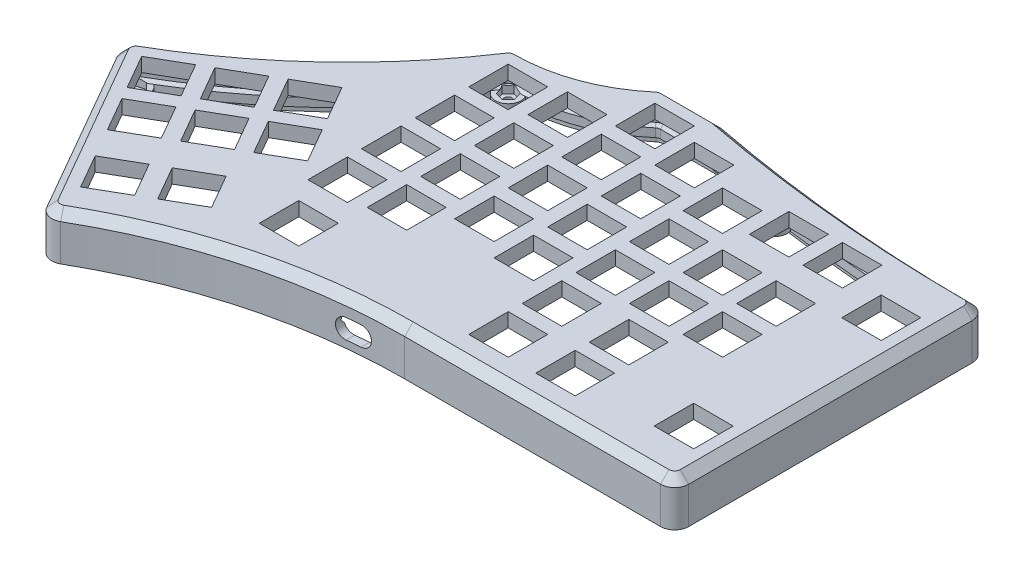
from build123d import *

# Parameters (mm, degrees)
SKETCH3_W                = 14
SKETCH3_H                = 14
MAIN_PLATE_DEPTH         = 5
MAIN_PLATE_CHAMFER_SIZE  = 3
WALL_DEPTH               = 11
NICE_NANO_RECESS_DEPTH   = 2
MAIN_SWITCH_RECESS_DEPTH = 2
SIDE_START               = -3
SIDE_DEPTH               = 3
FASTENERS_START          = -3
SKETCH8_R                = 1.35
FASTENERS_DEPTH          = 3
CHAMFER1_SIZE            = 1
NUT_SOCCETS_DEPTH        = 2
SKETCH11_R               = 3
MAGNET01_DEPTH           = 1.5
SKETCH10_R               = 3
MAGNET02_DEPTH           = 1.5
CHARGE_SOCCET_DEPTH      = 5


with BuildPart() as part:
    # Sketch3 → Main_plate (new body)
    with BuildSketch(Plane(origin=(0, 0, 0), x_dir=(1, 0, 0), z_dir=(0, 1, 0))):
        with BuildLine():
            Line((160, 22.5), (160, -78))
            ThreePointArc((160, -78), (158.535533906, -81.535533906), (155, -83))
            Line((155, -83), (64.287339008, -83))
            ThreePointArc((64.287339008, -83), (14.482679281, -89.533952399), (-31.951197412, -108.693591219))
            ThreePointArc((-31.951197412, -108.693591219), (-35.746191671, -109.186216339), (-38.77799641, -106.851088727))
            Line((-38.77799641, -106.851088727), (-72.421997828, -48.333303664))
            ThreePointArc((-72.421997828, -48.333303664), (-72.914622948, -44.538309405), (-70.579495335, -41.506504666))
            ThreePointArc((-70.579495335, -41.506504666), (-33.753261114, -14.230305993), (-4.165423102, 20.765727822))
            ThreePointArc((-4.165423102, 20.765727822), (-2.363404419, 22.406168353), (0, 23))
            ThreePointArc((0, 23), (18.519929937, 26.303047313), (34.756097561, 35.804878049))
            ThreePointArc((34.756097561, 35.804878049), (36.271473206, 36.691715584), (38, 37))
            Line((38, 37), (56, 37))
            ThreePointArc((56, 37), (56.477604071, 36.977137164), (56.950840389, 36.90875774))
            ThreePointArc((56.950840389, 36.90875774), (105.750222278, 29.85757953), (155, 27.5))
            ThreePointArc((155, 27.5), (158.535533906, 26.035533906), (160, 22.5))
        make_face()
        with Locations((104, 13.5)):
            Rectangle(SKETCH3_W, SKETCH3_H, mode=Mode.SUBTRACT)
        Polygon((-65.356627483, -46.578156408), (-53.219605396, -39.600141299), (-46.241590287, -51.737163386), (-58.378612374, -58.715178495), align=None, mode=Mode.SUBTRACT)
        with Locations((9, -10)):
            Rectangle(SKETCH3_W, SKETCH3_H, mode=Mode.SUBTRACT)
        with Locations((9, 9)):
            Rectangle(SKETCH3_W, SKETCH3_H, mode=Mode.SUBTRACT)
        with Locations((28, 11)):
            Rectangle(SKETCH3_W, SKETCH3_H, mode=Mode.SUBTRACT)
        with Locations((47, 23)):
            Rectangle(SKETCH3_W, SKETCH3_H, mode=Mode.SUBTRACT)
        with Locations((66, 18)):
            Rectangle(SKETCH3_W, SKETCH3_H, mode=Mode.SUBTRACT)
        with Locations((85, 9)):
            Rectangle(SKETCH3_W, SKETCH3_H, mode=Mode.SUBTRACT)
        with Locations((104, -10)):
            Rectangle(SKETCH3_W, SKETCH3_H, mode=Mode.SUBTRACT)
        with Locations((123, -10)):
            Rectangle(SKETCH3_W, SKETCH3_H, mode=Mode.SUBTRACT)
        with Locations((146, 4.25)):
            Rectangle(SKETCH3_W, SKETCH3_H, mode=Mode.SUBTRACT)
        with Locations((146, -62.25)):
            Rectangle(SKETCH3_W, SKETCH3_H, mode=Mode.SUBTRACT)
        with Locations((28, -8)):
            Rectangle(SKETCH3_W, SKETCH3_H, mode=Mode.SUBTRACT)
        with Locations((47, 4)):
            Rectangle(SKETCH3_W, SKETCH3_H, mode=Mode.SUBTRACT)
        with Locations((66, -1)):
            Rectangle(SKETCH3_W, SKETCH3_H, mode=Mode.SUBTRACT)
        with Locations((85, -10)):
            Rectangle(SKETCH3_W, SKETCH3_H, mode=Mode.SUBTRACT)
        with Locations((104, -29)):
            Rectangle(SKETCH3_W, SKETCH3_H, mode=Mode.SUBTRACT)
        with Locations((123, -29)):
            Rectangle(SKETCH3_W, SKETCH3_H, mode=Mode.SUBTRACT)
        with Locations((9, -29)):
            Rectangle(SKETCH3_W, SKETCH3_H, mode=Mode.SUBTRACT)
        with Locations((28, -27)):
            Rectangle(SKETCH3_W, SKETCH3_H, mode=Mode.SUBTRACT)
        with Locations((47, -15)):
            Rectangle(SKETCH3_W, SKETCH3_H, mode=Mode.SUBTRACT)
        with Locations((66, -20)):
            Rectangle(SKETCH3_W, SKETCH3_H, mode=Mode.SUBTRACT)
        with Locations((85, -29)):
            Rectangle(SKETCH3_W, SKETCH3_H, mode=Mode.SUBTRACT)
        with Locations((9, -48)):
            Rectangle(SKETCH3_W, SKETCH3_H, mode=Mode.SUBTRACT)
        with Locations((28, -46)):
            Rectangle(SKETCH3_W, SKETCH3_H, mode=Mode.SUBTRACT)
        with Locations((47, -34)):
            Rectangle(SKETCH3_W, SKETCH3_H, mode=Mode.SUBTRACT)
        with Locations((66, -39)):
            Rectangle(SKETCH3_W, SKETCH3_H, mode=Mode.SUBTRACT)
        with Locations((85, -48)):
            Rectangle(SKETCH3_W, SKETCH3_H, mode=Mode.SUBTRACT)
        with Locations((13.75, -70)):
            Rectangle(SKETCH3_W, SKETCH3_H, mode=Mode.SUBTRACT)
        with Locations((108.75, -67)):
            Rectangle(SKETCH3_W, SKETCH3_H, mode=Mode.SUBTRACT)
        Polygon((-30.91487853, -78.39526547), (-43.051900617, -85.373280579), (-36.073885508, -97.510302666), (-23.936863421, -90.532287557), align=None, mode=Mode.SUBTRACT)
        Polygon((-25.713297636, -75.404687566), (-13.576275549, -68.426672458), (-6.59826044, -80.563694545), (-18.735282527, -87.541709654), align=None, mode=Mode.SUBTRACT)
        with Locations((123, 13.5)):
            Rectangle(SKETCH3_W, SKETCH3_H, mode=Mode.SUBTRACT)
        with Locations((108.75, -48)):
            Rectangle(SKETCH3_W, SKETCH3_H, mode=Mode.SUBTRACT)
        Polygon((-55.886464121, -63.04982924), (-43.749442034, -56.071814132), (-36.771426925, -68.208836219), (-48.908449012, -75.186851327), align=None, mode=Mode.SUBTRACT)
        Polygon((-48.884954651, -37.107993046), (-36.747932564, -30.129977937), (-29.769917455, -42.267000024), (-41.906939542, -49.245015133), align=None, mode=Mode.SUBTRACT)
        Polygon((-32.413281818, -27.637829684), (-20.276259731, -20.659814575), (-13.298244622, -32.796836662), (-25.435266709, -39.774851771), align=None, mode=Mode.SUBTRACT)
        Polygon((-22.943118456, -44.109502517), (-10.806096369, -37.131487408), (-3.82808126, -49.268509495), (-15.965103347, -56.246524604), align=None, mode=Mode.SUBTRACT)
        Polygon((-39.414791289, -53.579665878), (-27.277769202, -46.60165077), (-20.299754093, -58.738672857), (-32.43677618, -65.716687966), align=None, mode=Mode.SUBTRACT)
        with Locations((85, -67)):
            Rectangle(SKETCH3_W, SKETCH3_H, mode=Mode.SUBTRACT)
    extrude(amount=-MAIN_PLATE_DEPTH)

    # Main_plate_chamfer
    main_plate_chamfer_edges = [part.edges().sort_by_distance(p)[0] for p in [
        (-35.746191671, 0, 109.186216339),
        (-55.599997119, 0, 77.592196196),
        (-72.914622948, 0, 44.538309405),
        (-33.753261114, 0, 14.230305993),
        (-2.363404419, 0, -22.406168353),
        (18.519929937, 0, -26.303047313),
        (36.271473206, 0, -36.691715584),
        (47, 0, -37),
        (56.477604071, 0, -36.977137164),
        (105.750222278, 0, -29.85757953),
        (158.535533906, 0, -26.035533906),
        (160, 0, 27.75),
        (158.535533906, 0, 81.535533906),
        (109.643669504, 0, 83),
        (14.482679281, 0, 89.533952399),
    ]]
    chamfer(main_plate_chamfer_edges, length=MAIN_PLATE_CHAMFER_SIZE)

    # Sketch4 → Wall (add)
    with BuildSketch(Plane.XZ.offset(5)):
        with BuildLine():
            Line((155, 83), (64.287339008, 83))
            ThreePointArc((64.287339008, 83), (14.482679281, 89.533952399), (-31.951197412, 108.693591219))
            ThreePointArc((-31.951197412, 108.693591219), (-35.746191671, 109.186216339), (-38.77799641, 106.851088727))
            Line((-38.77799641, 106.851088727), (-72.421997828, 48.333303664))
            ThreePointArc((-72.421997828, 48.333303664), (-72.914622948, 44.538309405), (-70.579495335, 41.506504666))
            ThreePointArc((-70.579495335, 41.506504666), (-33.753261114, 14.230305993), (-4.165423102, -20.765727822))
            ThreePointArc((-4.165423102, -20.765727822), (-2.363404419, -22.406168353), (0, -23))
            ThreePointArc((0, -23), (18.519929937, -26.303047313), (34.756097561, -35.804878049))
            ThreePointArc((34.756097561, -35.804878049), (36.271473206, -36.691715584), (38, -37))
            Line((38, -37), (56, -37))
            ThreePointArc((56, -37), (56.477604071, -36.977137164), (56.950840389, -36.90875774))
            ThreePointArc((56.950840389, -36.90875774), (105.750222278, -29.85757953), (155, -27.5))
            ThreePointArc((155, -27.5), (158.535533906, -26.035533906), (160, -22.5))
            Line((160, -22.5), (160, 78))
            ThreePointArc((160, 78), (158.535533906, 81.535533906), (155, 83))
        make_face()
        with BuildLine():
            Line((-37.044136112, 105.854229426), (-70.68813753, 47.336444363))
            ThreePointArc((-70.68813753, 47.336444363), (-70.983712602, 45.059447807), (-69.582636034, 43.240364964))
            ThreePointArc((-69.582636034, 43.240364964), (-32.385273168, 15.689281312), (-2.499253861, -19.659436693))
            ThreePointArc((-2.499253861, -19.659436693), (-1.418042651, -20.643701012), (0, -21))
            ThreePointArc((0, -21), (19.211340655, -24.42636108), (36.053658537, -34.282926829))
            ThreePointArc((36.053658537, -34.282926829), (36.962883924, -34.81502935), (38, -35))
            Line((38, -35), (56, -35))
            ThreePointArc((56, -35), (56.286562443, -34.986282299), (56.570504234, -34.945254644))
            ThreePointArc((56.570504234, -34.945254644), (105.55918065, -27.866724665), (155, -25.5))
            ThreePointArc((155, -25.5), (157.121320344, -24.621320344), (158, -22.5))
            Line((158, -22.5), (158, 78))
            ThreePointArc((158, 78), (157.121320344, 80.121320344), (155, 81))
            Line((155, 81), (64.287339008, 81))
            ThreePointArc((64.287339008, 81), (13.966791986, 87.601632473), (-32.948056713, 106.959730921))
            ThreePointArc((-32.948056713, 106.959730921), (-35.225053269, 107.255305993), (-37.044136112, 105.854229426))
        make_face(mode=Mode.SUBTRACT)
    extrude(amount=WALL_DEPTH)

    # Sketch6 → Nice-nano_recess (cut)
    with BuildSketch(Plane.XZ.offset(5)):
        with BuildLine():
            Line((56.12, 75.25), (56.12, 44.77))
            ThreePointArc((56.12, 44.77), (54.62, 43.27), (53.12, 44.77))
            Line((53.12, 44.77), (53.12, 75.25))
            ThreePointArc((53.12, 75.25), (54.62, 76.75), (56.12, 75.25))
        make_face()
        with BuildLine():
            Line((40.88, 75.25), (40.88, 44.77))
            ThreePointArc((40.88, 44.77), (39.38, 43.27), (37.88, 44.77))
            Line((37.88, 44.77), (37.88, 75.25))
            ThreePointArc((37.88, 75.25), (39.38, 76.75), (40.88, 75.25))
        make_face()
    extrude(amount=-NICE_NANO_RECESS_DEPTH, mode=Mode.SUBTRACT)

    # Sketch12 → Main_switch_recess (cut)
    with BuildSketch(Plane.XZ.offset(5)):
        with BuildLine():
            Line((65, 76.5), (69, 76.5))
            ThreePointArc((69, 76.5), (70.5, 75), (69, 73.5))
            Line((69, 73.5), (65, 73.5))
            ThreePointArc((65, 73.5), (63.5, 75), (65, 76.5))
        make_face()
        with BuildLine():
            Line((65, 68.5), (69, 68.5))
            ThreePointArc((69, 68.5), (70.5, 70), (69, 71.5))
            Line((69, 71.5), (65, 71.5))
            ThreePointArc((65, 71.5), (63.5, 70), (65, 68.5))
        make_face()
    extrude(amount=-MAIN_SWITCH_RECESS_DEPTH, mode=Mode.SUBTRACT)

    # Sketch7 → Side (add)
    with BuildSketch(Plane(origin=(0, -14, 0), x_dir=(-1, 0, 0), z_dir=(0, -1, 0)).offset(SIDE_START)):
        with BuildLine():
            Line((-158, 22.5), (-158, -78))
            ThreePointArc((-158, -78), (-157.121320344, -80.121320344), (-155, -81))
            Line((-155, -81), (-64.287339008, -81))
            ThreePointArc((-64.287339008, -81), (-13.966791986, -87.601632473), (32.948056713, -106.959730921))
            ThreePointArc((32.948056713, -106.959730921), (35.225053269, -107.255305993), (37.044136112, -105.854229426))
            Line((37.044136112, -105.854229426), (70.68813753, -47.336444363))
            ThreePointArc((70.68813753, -47.336444363), (70.983712602, -45.059447807), (69.582636034, -43.240364964))
            ThreePointArc((69.582636034, -43.240364964), (32.385273168, -15.689281312), (2.499253861, 19.659436693))
            ThreePointArc((2.499253861, 19.659436693), (1.418042651, 20.643701012), (0, 21))
            ThreePointArc((0, 21), (-19.211340655, 24.42636108), (-36.053658537, 34.282926829))
            ThreePointArc((-36.053658537, 34.282926829), (-36.962883924, 34.81502935), (-38, 35))
            Line((-38, 35), (-56, 35))
            ThreePointArc((-56, 35), (-56.286562443, 34.986282299), (-56.570504234, 34.945254644))
            ThreePointArc((-56.570504234, 34.945254644), (-105.55918065, 27.866724665), (-155, 25.5))
            ThreePointArc((-155, 25.5), (-157.121320344, 24.621320344), (-158, 22.5))
        make_face()
        with BuildLine():
            Line((-38, 34), (-56, 34))
            ThreePointArc((-56, 34), (-56.191041629, 33.990854866), (-56.380336156, 33.963503096))
            ThreePointArc((-56.380336156, 33.963503096), (-105.463659835, 26.871297232), (-155, 24.5))
            ThreePointArc((-155, 24.5), (-156.414213562, 23.914213562), (-157, 22.5))
            Line((-157, 22.5), (-157, -78))
            ThreePointArc((-157, -78), (-156.414213562, -79.414213562), (-155, -80))
            Line((-155, -80), (-64.287339008, -80))
            ThreePointArc((-64.287339008, -80), (-13.708848338, -86.63547251), (33.446486364, -106.092800772))
            ThreePointArc((33.446486364, -106.092800772), (34.964484067, -106.28985082), (36.177205963, -105.355799775))
            Line((36.177205963, -105.355799775), (69.82120738, -46.838014712))
            ThreePointArc((69.82120738, -46.838014712), (70.018257429, -45.320017009), (69.084206384, -44.107295113))
            ThreePointArc((69.084206384, -44.107295113), (31.701279195, -16.418768971), (1.666169241, 19.106291129))
            ThreePointArc((1.666169241, 19.106291129), (0.945361767, 19.762467341), (0, 20))
            ThreePointArc((0, 20), (-19.557046014, 23.488017963), (-36.702439024, 33.52195122))
            ThreePointArc((-36.702439024, 33.52195122), (-37.308589282, 33.876686234), (-38, 34))
        make_face(mode=Mode.SUBTRACT)
    extrude(amount=SIDE_DEPTH)

    # Sketch8 → Fasteners (add)
    # profile 1 of 7: a face of its own
    with BuildSketch(Plane.XZ.offset(14).offset(FASTENERS_START)):
        with BuildLine():
            Line((72.584345221, 81), (79.292549153, 81))
            ThreePointArc((79.292549153, 81), (75.938447187, 73.5), (72.584345221, 81))
        make_face()
        with Locations(Location((75.938447187, 78, 0), (0, 0, 270))):
            Circle(SKETCH8_R, mode=Mode.SUBTRACT)
    # profile 2 of 7: a face of its own
    with BuildSketch(Plane.XZ.offset(14).offset(FASTENERS_START)):
        with BuildLine():
            Line((158, 78), (158, 74.645898034))
            ThreePointArc((158, 74.645898034), (151.818019485, 74.818019485), (151.645898034, 81))
            Line((151.645898034, 81), (155, 81))
            ThreePointArc((155, 81), (157.121320344, 80.121320344), (158, 78))
        make_face()
        with Locations(Location((155, 78, 0), (0, 0, 270))):
            Circle(SKETCH8_R, mode=Mode.SUBTRACT)
    # profile 3 of 7: a face of its own
    with BuildSketch(Plane.XZ.offset(14).offset(FASTENERS_START)):
        with BuildLine():
            Line((158, -19.145898034), (158, -22.5))
            ThreePointArc((158, -22.5), (157.121320344, -24.621320344), (155, -25.5))
            Line((155, -25.5), (151.655593741, -25.510805004))
            ThreePointArc((151.655593741, -25.510805004), (151.812890949, -19.3231563), (158, -19.145898034))
        make_face()
        with Locations(Location((155, -22.5, 0), (0, 0, 270))):
            Circle(SKETCH8_R, mode=Mode.SUBTRACT)
    # profile 4 of 7: a face of its own
    with BuildSketch(Plane.XZ.offset(14).offset(FASTENERS_START)):
        with BuildLine():
            Line((0, -21), (3.265663403, -21.096036585))
            ThreePointArc((3.265663403, -21.096036585), (2.168070686, -14.056718435), (-4.363800284, -16.90125204))
            Line((-4.363800284, -16.90125204), (-2.499253861, -19.659436693))
            ThreePointArc((-2.499253861, -19.659436693), (-1.418042651, -20.643701012), (0, -21))
        make_face()
        with Locations(Location((0, -18, 0), (0, 0, 270))):
            Circle(SKETCH8_R, mode=Mode.SUBTRACT)
    # profile 5 of 7: a face of its own
    with BuildSketch(Plane.XZ.offset(14).offset(FASTENERS_START)):
        with BuildLine():
            Line((-69.016353658, 50.244216481), (-70.68813753, 47.336444363))
            ThreePointArc((-70.68813753, 47.336444363), (-70.983712602, 45.059447807), (-69.582636034, 43.240364964))
            Line((-69.582636034, 43.240364964), (-66.710261221, 41.557041205))
            ThreePointArc((-66.710261221, 41.557041205), (-63.737985367, 46.995734413), (-69.016353658, 50.244216481))
        make_face()
        with Locations(Location((-68.087347082, 45.841155411, 0), (0, 0, 270))):
            Circle(SKETCH8_R, mode=Mode.SUBTRACT)
    # profile 6 of 7: a face of its own
    with BuildSketch(Plane.XZ.offset(14).offset(FASTENERS_START)):
        with BuildLine():
            Line((-37.044136112, 105.854229426), (-38.715919983, 102.946457308))
            ThreePointArc((-38.715919983, 102.946457308), (-33.252333202, 100.019414081), (-30.048338945, 105.325333734))
            Line((-30.048338945, 105.325333734), (-32.948056713, 106.959730921))
            ThreePointArc((-32.948056713, 106.959730921), (-35.225053269, 107.255305993), (-37.044136112, 105.854229426))
        make_face()
        with Locations(Location((-34.443345665, 104.358940474, 0), (0, 0, 270))):
            Circle(SKETCH8_R, mode=Mode.SUBTRACT)
    # profile 7 of 7: a face of its own
    with BuildSketch(Plane.XZ.offset(14).offset(FASTENERS_START)):
        with BuildLine():
            ThreePointArc((81.873992234, -30.691700873), (85.373293343, -30.204486821), (88.875838606, -29.741170024))
            ThreePointArc((88.875838606, -29.741170024), (84.394658116, -22.995616625), (81.873992234, -30.691700873))
        make_face()
        with Locations(Location((85, -27.454715324, 0), (0, 0, 270))):
            Circle(SKETCH8_R, mode=Mode.SUBTRACT)
    extrude(amount=FASTENERS_DEPTH)

    # Chamfer1
    chamfer1_edges = [part.edges().sort_by_distance(p)[0] for p in [
        (56.286562443, -11, -34.986282299),
        (47, -11, -35),
        (36.962883924, -11, -34.81502935),
        (19.211340655, -11, -24.42636108),
        (-1.418042651, -11, -20.643701012),
        (-32.385273168, -11, 15.689281312),
        (-70.983712602, -11, 45.059447807),
        (-53.866136821, -11, 76.595336894),
        (-35.225053269, -11, 107.255305993),
        (13.966791986, -11, 87.601632473),
        (109.643669504, -11, 81),
        (157.121320344, -11, 80.121320344),
        (158, -11, 27.75),
        (105.55918065, -11, -27.866724665),
    ]]
    chamfer(chamfer1_edges, length=CHAMFER1_SIZE - 0.0001)  # a hair under: the kernel refuses the full size

    # Sketch9 → Nut_soccets (cut, symmetric)
    with BuildSketch(Plane(origin=(0, -11, 0), x_dir=(1, 0, 0), z_dir=(0, 1, 0))):
        Polygon((-65.188167162, -45.069951295), (-67.305639478, -42.944789892), (-70.204819399, -43.715994008), (-70.986527003, -46.612359528), (-68.869054686, -48.737520931), (-65.969874766, -47.966316814), align=None)
        Polygon((-32.943345665, -101.760864262), (-35.943345665, -101.760864262), (-37.443345665, -104.358940474), (-35.943345665, -106.957016685), (-32.943345665, -106.957016685), (-31.443345665, -104.358940474), align=None)
        Polygon((78.536523399, -76.5), (75.938447187, -75), (73.340370976, -76.5), (73.340370976, -79.5), (75.938447187, -81), (78.536523399, -79.5), align=None)
        Polygon((153.5, -75.401923789), (152, -78), (153.5, -80.598076211), (156.5, -80.598076211), (158, -78), (156.5, -75.401923789), align=None)
        Polygon((2.897777479, 17.223542865), (2.121320344, 20.121320344), (-0.776457135, 20.897777479), (-2.897777479, 18.776457135), (-2.121320344, 15.878679656), (0.776457135, 15.102222521), align=None)
        Polygon((86.5, 24.856639112), (88, 27.454715324), (86.5, 30.052791535), (83.5, 30.052791535), (82, 27.454715324), (83.5, 24.856639112), align=None)
        Polygon((153.5, 19.901923789), (156.5, 19.901923789), (158, 22.5), (156.5, 25.098076211), (153.5, 25.098076211), (152, 22.5), align=None)
    extrude(amount=NUT_SOCCETS_DEPTH, both=True, mode=Mode.SUBTRACT)

    # Sketch11 → Magnet01 (cut)
    with BuildSketch(Plane(origin=(37.533909435, 0, 65.283591498), x_dir=(-0.8669301490733572, 0, 0.49842965063050443), z_dir=(-0.49842965063050443, 0, -0.8669301490733572))):
        with Locations((71.875565032, -8)):
            Circle(SKETCH11_R)
    extrude(amount=-MAGNET01_DEPTH, mode=Mode.SUBTRACT)

    # Sketch10 → Magnet02 (cut)
    with BuildSketch(Plane.XY.offset(80)):
        with Locations(Location((145, -8, 0), (0, 0, 221.810314896))):
            Circle(SKETCH10_R)
    extrude(amount=MAGNET02_DEPTH, mode=Mode.SUBTRACT)

    # Sketch5 → Charge_soccet (cut, symmetric)
    with BuildSketch(Plane.XY.offset(83)):
        with BuildLine():
            Line((44.6, -6.53), (49.4, -6.53))
            ThreePointArc((49.4, -6.53), (52.85, -9.98), (49.4, -13.43))
            Line((49.4, -13.43), (44.6, -13.43))
            ThreePointArc((44.6, -13.43), (41.15, -9.98), (44.6, -6.53))
        make_face()
    extrude(amount=CHARGE_SOCCET_DEPTH, both=True, mode=Mode.SUBTRACT)


solid = part.part
